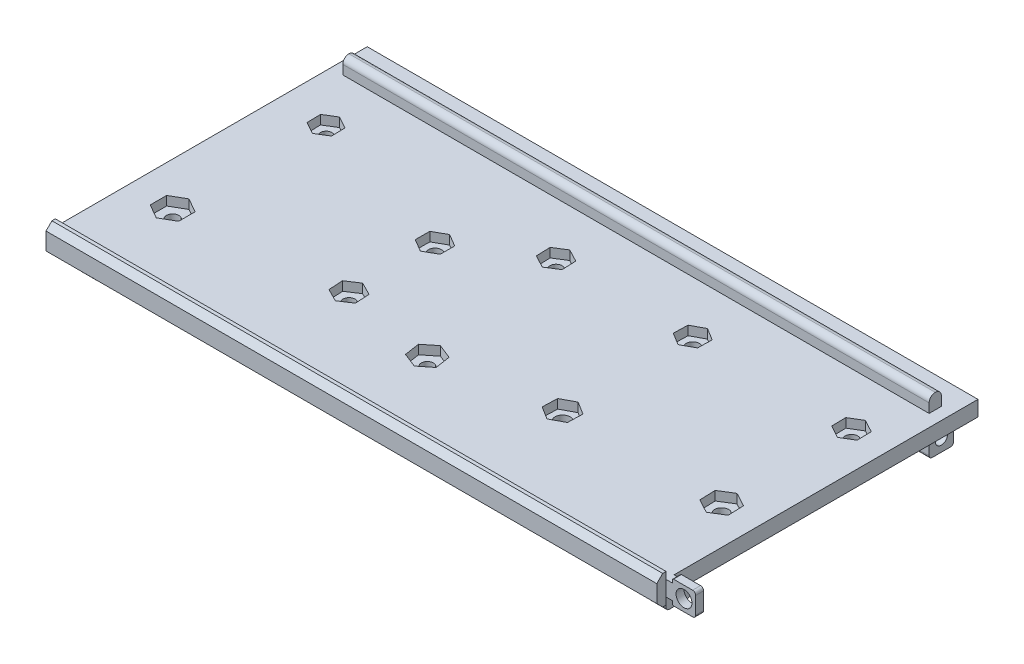
from build123d import *

# Parameters (mm, degrees)
CROQUIS3_W              = 200
CROQUIS3_H              = 100
CROQUIS3_R              = 2.45
CROQUIS3_R_2            = 2.450173308
SALIENTE_EXTRUIR1_DEPTH = 5
SALIENTE_EXTRUIR2_START = -9
CROQUIS4_R              = 3.872577113
CROQUIS4_R_2            = 1.872577113
CROQUIS4_R_3            = 4.027614965
CROQUIS4_R_4            = 2.027614965
CROQUIS4_R_5            = 3.962984948
CROQUIS4_R_6            = 1.962984948
CROQUIS4_R_7            = 3.978351446
CROQUIS4_R_8            = 1.978351446
CROQUIS4_R_9            = 3.959412365
CROQUIS4_R_10           = 1.959412365
CROQUIS4_R_11           = 4.125491316
CROQUIS4_R_12           = 2.125491316
CROQUIS4_R_13           = 4.450173308
CROQUIS4_R_14           = 2.450173308
CROQUIS4_R_15           = 4.124173106
CROQUIS4_R_16           = 2.124173106
CROQUIS4_R_17           = 4.031387243
CROQUIS4_R_18           = 2.031387243
CROQUIS4_R_19           = 4.264908663
CROQUIS4_R_20           = 2.264908663
SALIENTE_EXTRUIR2_DEPTH = 9
SALIENTE_EXTRUIR3_DEPTH = 200
CROQUIS9_W              = 5
CROQUIS9_H              = 8
SALIENTE_EXTRUIR4_DEPTH = 8
REDONDEO1_R             = 1
CROQUIS11_W             = 8
CROQUIS11_H             = 6
SALIENTE_EXTRUIR5_DEPTH = 8
REDONDEO3_R             = 2
CROQUIS12_W             = 192
CROQUIS12_H             = 4
SALIENTE_EXTRUIR6_DEPTH = 5
REDONDEO4_R             = 2
CROQUIS13_R             = 2
CORTAR_EXTRUIR3_DEPTH   = 6
CORTAR_EXTRUIR4_START   = -6
CROQUIS14_R             = 2
CORTAR_EXTRUIR4_DEPTH   = 6
CROQUIS15_R             = 2
CORTAR_EXTRUIR5_DEPTH   = 6
CORTAR_EXTRUIR6_DEPTH   = 2.6
MATRIZL1_COUNT          = 2
MATRIZL1_PITCH          = 184.6
CORTAR_EXTRUIR7_DEPTH   = 2.6
MATRIZL2_COUNT          = 2
MATRIZL2_PITCH          = 100
CROQUIS19_R             = 2.6
SALIENTE_EXTRUIR7_DEPTH = 2.6
CROQUIS25_R             = 1.872577113
CROQUIS25_R_2           = 2.125491316
CROQUIS25_R_3           = 1.959412365
CROQUIS25_R_4           = 1.978351446
CROQUIS25_R_5           = 1.962984948
CROQUIS25_R_6           = 2.027614965
CORTAR_EXTRUIR8_DEPTH   = 10
CORTAR_EXTRUIR9_START   = 2
CORTAR_EXTRUIR9_DEPTH   = 14


with BuildPart() as part:
    # Croquis3 → Saliente-Extruir1 (new body)
    with BuildSketch(Plane(origin=(0, 0, 0), x_dir=(1, 0, 0), z_dir=(0, 1, 0))):
        with Locations((-16.001013851, 0)):
            Rectangle(CROQUIS3_W, CROQUIS3_H)
        with Locations(Location((19.48962591, 21.100676249, 0), (0, 0, 270))):
            Circle(CROQUIS3_R, mode=Mode.SUBTRACT)
        with Locations(Location((71.658007858, 20.901971031, 0), (0, 0, 270))):
            Circle(CROQUIS3_R, mode=Mode.SUBTRACT)
        with Locations(Location((71.377578013, -21.310716777, 0), (0, 0, 270))):
            Circle(CROQUIS3_R, mode=Mode.SUBTRACT)
        with Locations(Location((19.142498915, -21.188320431, 0), (0, 0, 270))):
            Circle(CROQUIS3_R_2, mode=Mode.SUBTRACT)
    extrude(amount=SALIENTE_EXTRUIR1_DEPTH)

    # Croquis4 → Saliente-Extruir2 (add)
    # profile 1 of 10: a face of its own
    with BuildSketch(Plane(origin=(0, 5, 0), x_dir=(1, 0, 0), z_dir=(0, 1, 0)).offset(SALIENTE_EXTRUIR2_START)):
        with Locations(Location((-100.480439359, 20.992110562, 0), (0, 0, 270))):
            Circle(CROQUIS4_R)
        with Locations(Location((-100.480439359, 20.992110562, 0), (0, 0, 270))):
            Circle(CROQUIS4_R_2, mode=Mode.SUBTRACT)
    # profile 2 of 10: a face of its own
    with BuildSketch(Plane(origin=(0, 5, 0), x_dir=(1, 0, 0), z_dir=(0, 1, 0)).offset(SALIENTE_EXTRUIR2_START)):
        with Locations(Location((-102.015729903, -27.700935731, 0), (0, 0, 270))):
            Circle(CROQUIS4_R_3)
        with Locations(Location((-102.015729903, -27.700935731, 0), (0, 0, 270))):
            Circle(CROQUIS4_R_4, mode=Mode.SUBTRACT)
    # profile 3 of 10: a face of its own
    with BuildSketch(Plane(origin=(0, 5, 0), x_dir=(1, 0, 0), z_dir=(0, 1, 0)).offset(SALIENTE_EXTRUIR2_START)):
        with Locations(Location((-49.441800463, -22.528991034, 0), (0, 0, 270))):
            Circle(CROQUIS4_R_5)
        with Locations(Location((-49.441800463, -22.528991034, 0), (0, 0, 270))):
            Circle(CROQUIS4_R_6, mode=Mode.SUBTRACT)
    # profile 4 of 10: a face of its own
    with BuildSketch(Plane(origin=(0, 5, 0), x_dir=(1, 0, 0), z_dir=(0, 1, 0)).offset(SALIENTE_EXTRUIR2_START)):
        with Locations(Location((-18.498106368, -27.825911713, 0), (0, 0, 270))):
            Circle(CROQUIS4_R_7)
        with Locations(Location((-18.498106368, -27.825911713, 0), (0, 0, 270))):
            Circle(CROQUIS4_R_8, mode=Mode.SUBTRACT)
    # profile 5 of 10: a face of its own
    with BuildSketch(Plane(origin=(0, 5, 0), x_dir=(1, 0, 0), z_dir=(0, 1, 0)).offset(SALIENTE_EXTRUIR2_START)):
        with Locations(Location((-25.022694884, 20.853145854, 0), (0, 0, 270))):
            Circle(CROQUIS4_R_9)
        with Locations(Location((-25.022694884, 20.853145854, 0), (0, 0, 270))):
            Circle(CROQUIS4_R_10, mode=Mode.SUBTRACT)
    # profile 6 of 10: a face of its own
    with BuildSketch(Plane(origin=(0, 5, 0), x_dir=(1, 0, 0), z_dir=(0, 1, 0)).offset(SALIENTE_EXTRUIR2_START)):
        with Locations(Location((-49.30076997, 5.486136923, 0), (0, 0, 270))):
            Circle(CROQUIS4_R_11)
        with Locations(Location((-49.30076997, 5.486136923, 0), (0, 0, 270))):
            Circle(CROQUIS4_R_12, mode=Mode.SUBTRACT)
    # profile 7 of 10: a face of its own
    with BuildSketch(Plane(origin=(0, 5, 0), x_dir=(1, 0, 0), z_dir=(0, 1, 0)).offset(SALIENTE_EXTRUIR2_START)):
        with Locations(Location((19.142498915, -21.188320431, 0), (0, 0, 270))):
            Circle(CROQUIS4_R_13)
        with Locations(Location((19.142498915, -21.188320431, 0), (0, 0, 270))):
            Circle(CROQUIS4_R_14, mode=Mode.SUBTRACT)
    # profile 8 of 10: a face of its own
    with BuildSketch(Plane(origin=(0, 5, 0), x_dir=(1, 0, 0), z_dir=(0, 1, 0)).offset(SALIENTE_EXTRUIR2_START)):
        with Locations(Location((19.48962591, 21.100676249, 0), (0, 0, 270))):
            Circle(CROQUIS4_R_15)
        with Locations(Location((19.48962591, 21.100676249, 0), (0, 0, 270))):
            Circle(CROQUIS4_R_16, mode=Mode.SUBTRACT)
    # profile 9 of 10: a face of its own
    with BuildSketch(Plane(origin=(0, 5, 0), x_dir=(1, 0, 0), z_dir=(0, 1, 0)).offset(SALIENTE_EXTRUIR2_START)):
        with Locations(Location((71.658007858, 20.901971031, 0), (0, 0, 270))):
            Circle(CROQUIS4_R_17)
        with Locations(Location((71.658007858, 20.901971031, 0), (0, 0, 270))):
            Circle(CROQUIS4_R_18, mode=Mode.SUBTRACT)
    # profile 10 of 10: a face of its own
    with BuildSketch(Plane(origin=(0, 5, 0), x_dir=(1, 0, 0), z_dir=(0, 1, 0)).offset(SALIENTE_EXTRUIR2_START)):
        with Locations(Location((71.377578013, -21.310716777, 0), (0, 0, 270))):
            Circle(CROQUIS4_R_19)
        with Locations(Location((71.377578013, -21.310716777, 0), (0, 0, 270))):
            Circle(CROQUIS4_R_20, mode=Mode.SUBTRACT)
    extrude(amount=SALIENTE_EXTRUIR2_DEPTH)

    # Croquis8 → Saliente-Extruir3 (add)
    with BuildSketch(Plane(origin=(83.998986149, 0, 0), x_dir=(0, 0, -1), z_dir=(1, 0, 0))):
        Polygon((-50, 5), (-52.132961521, 5), (-52.132961521, 7.264269383), (-53.250029395, 7.264269383), (-55.186280375, 5.328018403), (-55.186280375, -0.328018403), (-53.250029395, -2.264269383), (-52.132961521, -2.264269383), (-52.132961521, 0), (-50, 0), align=None)
    extrude(amount=-SALIENTE_EXTRUIR3_DEPTH)

    # Croquis9 → Saliente-Extruir4 (add)
    with BuildSketch(Plane.XZ):
        with Locations((-109.501013851, 44.132961521)):
            Rectangle(CROQUIS9_W, CROQUIS9_H)
        with Locations((77.498986149, 44.132961521)):
            Rectangle(CROQUIS9_W, CROQUIS9_H)
        with Locations((77.498986149, -42)):
            Rectangle(CROQUIS9_W, CROQUIS9_H)
        with Locations((-109.501013851, -42)):
            Rectangle(CROQUIS9_W, CROQUIS9_H)
    extrude(amount=SALIENTE_EXTRUIR4_DEPTH)

    # Redondeo1
    redondeo1_edges = [part.edges().sort_by_distance(p)[0] for p in [
        (-109.501013851, -8, 40.132961521),
        (-109.501013851, -8, 48.132961521),
        (77.498986149, -8, 40.132961521),
        (77.498986149, -8, 48.132961521),
        (77.498986149, -8, -46),
        (77.498986149, -8, -38),
        (-109.501013851, -8, -46),
        (-109.501013851, -8, -38),
    ]]
    fillet(redondeo1_edges, radius=REDONDEO1_R)

    # Croquis11 → Saliente-Extruir5 (add)
    with BuildSketch(Plane.XZ):
        with Locations((-53.435930005, -43)):
            Rectangle(CROQUIS11_W, CROQUIS11_H)
        with Locations((46.564069995, -43)):
            Rectangle(CROQUIS11_W, CROQUIS11_H)
    extrude(amount=SALIENTE_EXTRUIR5_DEPTH)

    # Redondeo3
    redondeo3_edges = [part.edges().sort_by_distance(p)[0] for p in [
        (-57.435930005, -8, -43),
        (-49.435930005, -8, -43),
        (42.564069995, -8, -43),
        (50.564069995, -8, -43),
    ]]
    fillet(redondeo3_edges, radius=REDONDEO3_R)

    # Croquis12 → Saliente-Extruir6 (add)
    with BuildSketch(Plane(origin=(0, 5, 0), x_dir=(1, 0, 0), z_dir=(0, 1, 0))):
        with Locations((-16.001013851, 40)):
            Rectangle(CROQUIS12_W, CROQUIS12_H)
    extrude(amount=SALIENTE_EXTRUIR6_DEPTH)

    # Redondeo4
    redondeo4_edges = [part.edges().sort_by_distance(p)[0] for p in [
        (-16.001013851, 10, -38),
        (-16.001013851, 10, -42),
    ]]
    fillet(redondeo4_edges, radius=REDONDEO4_R - 0.0001)  # a hair under: the kernel refuses the full size

    # Croquis13 → Cortar-Extruir3 (cut)
    with BuildSketch(Plane.ZY.offset(112.001013851)):
        with Locations((-42, -4)):
            Circle(CROQUIS13_R)
        with Locations((44.132961521, -4)):
            Circle(CROQUIS13_R)
    extrude(amount=-CORTAR_EXTRUIR3_DEPTH, mode=Mode.SUBTRACT)

    # Croquis14 → Cortar-Extruir4 (cut)
    with BuildSketch(Plane(origin=(79.998986149, 0, 0), x_dir=(0, 0, -1), z_dir=(1, 0, 0)).offset(CORTAR_EXTRUIR4_START)):
        with Locations(Location((-44.132961521, -4, 0), (0, 0, 180))):
            Circle(CROQUIS14_R)
        with Locations(Location((42, -4, 0), (0, 0, 180))):
            Circle(CROQUIS14_R)
    extrude(amount=CORTAR_EXTRUIR4_DEPTH, mode=Mode.SUBTRACT)

    # Croquis15 → Cortar-Extruir5 (cut)
    with BuildSketch(Plane(origin=(0, 0, -46), x_dir=(-1, 0, 0), z_dir=(0, 0, -1))):
        with Locations((-46.564069995, -4)):
            Circle(CROQUIS15_R)
        with Locations((53.435930005, -4)):
            Circle(CROQUIS15_R)
    extrude(amount=-CORTAR_EXTRUIR5_DEPTH, mode=Mode.SUBTRACT)

    # Croquis16 → Cortar-Extruir6 (cut)
    with BuildSketch(Plane(origin=(-107.001013851, 0, 0), x_dir=(0, 0, -1), z_dir=(1, 0, 0))):
        Polygon((39.158006208, -5.589424829), (41.955485383, -7.255951236), (44.797479175, -5.666526407), (44.841993792, -2.410575171), (42.044514617, -0.744048764), (39.202520825, -2.333473593), align=None)
        Polygon((-46.865222278, -5.771426305), (-43.964991718, -7.251920378), (-41.232730961, -5.480494073), (-41.400700764, -2.228573695), (-44.300931324, -0.748079622), (-47.033192081, -2.519505927), align=None)
    cortar_extruir6 = extrude(amount=-CORTAR_EXTRUIR6_DEPTH, mode=Mode.SUBTRACT)

    # MatrizL1: Cortar-Extruir6 ×2
    with Locations(*[(i * MATRIZL1_PITCH, 0, 0) for i in range(1, MATRIZL1_COUNT)]):
        add(cortar_extruir6, mode=Mode.SUBTRACT)

    # Croquis17 → Cortar-Extruir7 (cut)
    with BuildSketch(Plane.XY.offset(-40)):
        Polygon((49.376038588, -2.358040004), (46.548075223, -0.743783765), (43.736106629, -2.385743761), (43.752101401, -5.641959996), (46.580064767, -7.256216235), (49.39203336, -5.614256239), align=None)
    cortar_extruir7 = extrude(amount=-CORTAR_EXTRUIR7_DEPTH, mode=Mode.SUBTRACT)

    # MatrizL2: Cortar-Extruir7 ×2
    with Locations(*[(-i * MATRIZL2_PITCH, 0, 0) for i in range(1, MATRIZL2_COUNT)]):
        add(cortar_extruir7, mode=Mode.SUBTRACT)

    # Croquis19 → Saliente-Extruir7 (add)
    with BuildSketch(Plane(origin=(0, 0, 52.132961521), x_dir=(-1, 0, 0), z_dir=(0, 0, -1))):
        with BuildLine():
            Line((-83.998986149, 5), (-86.059648262, 5))
            Line((-86.059648262, 5), (-86.059648262, 5.887012828))
            ThreePointArc((-86.059648262, 5.887012828), (-86.176805549, 6.16985554), (-86.459648262, 6.287012828))
            Line((-86.459648262, 6.287012828), (-92.668778181, 6.287012828))
            ThreePointArc((-92.668778181, 6.287012828), (-93.375884962, 5.994119609), (-93.668778181, 5.287012828))
            Line((-93.668778181, 5.287012828), (-93.668778181, -0.287012828))
            ThreePointArc((-93.668778181, -0.287012828), (-93.375884962, -0.994119609), (-92.668778181, -1.287012828))
            Line((-92.668778181, -1.287012828), (-86.459648262, -1.287012828))
            ThreePointArc((-86.459648262, -1.287012828), (-86.176805549, -1.16985554), (-86.059648262, -0.887012828))
            Line((-86.059648262, -0.887012828), (-86.059648262, 0))
            Line((-86.059648262, 0), (-83.998986149, 0))
            Line((-83.998986149, 0), (-83.998986149, 5))
        make_face()
        with Locations((-89.864213222, 2.5)):
            Circle(CROQUIS19_R, mode=Mode.SUBTRACT)
    extrude(amount=SALIENTE_EXTRUIR7_DEPTH)

    # Croquis25 → Cortar-Extruir8 (cut)
    with BuildSketch(Plane(origin=(0, 0, 0), x_dir=(1, 0, 0), z_dir=(0, 1, 0))):
        with Locations(Location((-100.480439359, 20.992110562, 0), (0, 0, 270))):
            Circle(CROQUIS25_R)
        with Locations(Location((-49.30076997, 5.486136923, 0), (0, 0, 270))):
            Circle(CROQUIS25_R_2)
        with Locations(Location((-25.022694884, 20.853145854, 0), (0, 0, 270))):
            Circle(CROQUIS25_R_3)
        with Locations(Location((-18.498106368, -27.825911713, 0), (0, 0, 270))):
            Circle(CROQUIS25_R_4)
        with Locations(Location((-49.441800463, -22.528991034, 0), (0, 0, 270))):
            Circle(CROQUIS25_R_5)
        with Locations(Location((-102.015729903, -27.700935731, 0), (0, 0, 270))):
            Circle(CROQUIS25_R_6)
    extrude(amount=CORTAR_EXTRUIR8_DEPTH, mode=Mode.SUBTRACT)

    # Croquis26 → Cortar-Extruir9 (cut)
    with BuildSketch(Plane(origin=(0, 0, 0), x_dir=(1, 0, 0), z_dir=(0, 1, 0)).offset(CORTAR_EXTRUIR9_START)):
        Polygon((-96.607862246, 23.3462389), (-100.582885747, 25.522924889), (-104.45546286, 23.168796551), (-104.353016472, 18.637982224), (-100.377992971, 16.461296235), (-96.505415858, 18.815424573), align=None)
        Polygon((-102.015729903, -33.067693131), (-97.367981659, -30.384314431), (-97.367981659, -25.017557031), (-102.015729903, -22.334178332), (-106.663478148, -25.017557031), (-106.663478148, -30.384314431), align=None)
        Polygon((-45.175278654, 7.827843357), (-49.266001572, 10.229770423), (-53.391492888, 7.888063989), (-53.426261286, 3.144430489), (-49.335538368, 0.742503423), (-45.210047052, 3.084209857), align=None)
        Polygon((-45.478815515, -19.92269926), (-49.717422875, -17.793799507), (-53.680407822, -20.400091281), (-53.40478541, -25.135282807), (-49.166178051, -27.26418256), (-45.203193103, -24.657890786), align=None)
        Polygon((-14.519754921, -24.657890786), (-19.252517247, -22.796547832), (-23.230868693, -25.964568758), (-22.476457814, -30.993932639), (-17.743695489, -32.855275594), (-13.765344042, -29.687254667), align=None)
        Polygon((-21.063282519, 23.3462389), (-25.202070613, 25.52864407), (-29.161482978, 23.035551024), (-28.982107249, 18.360052809), (-24.843319155, 16.177647639), (-20.88390679, 18.670740685), align=None)
        Polygon((23.613799016, 23.3462389), (19.606998162, 25.795096254), (15.482825056, 23.549533604), (15.365452804, 18.855113599), (19.372253658, 16.406256245), (23.496426764, 18.651818895), align=None)
        Polygon((75.689395101, 23.3462389), (71.556903412, 25.615388731), (67.525516169, 23.171120862), (67.626620615, 18.457703163), (71.759112304, 16.188553332), (75.790499547, 18.632821201), align=None)
        Polygon((75.790499547, -18.566006086), (71.207049596, -16.116659278), (66.794128062, -18.861369968), (66.964656479, -24.055427467), (71.54810643, -26.504774275), (75.961027964, -23.760063585), align=None)
        Polygon((23.496426764, -18.861369968), (19.304264625, -16.254233076), (14.950336776, -18.581183539), (14.788571066, -23.515270894), (18.980733205, -26.122407786), (23.334661054, -23.795457323), align=None)
    extrude(amount=CORTAR_EXTRUIR9_DEPTH, mode=Mode.SUBTRACT)


solid = part.part
